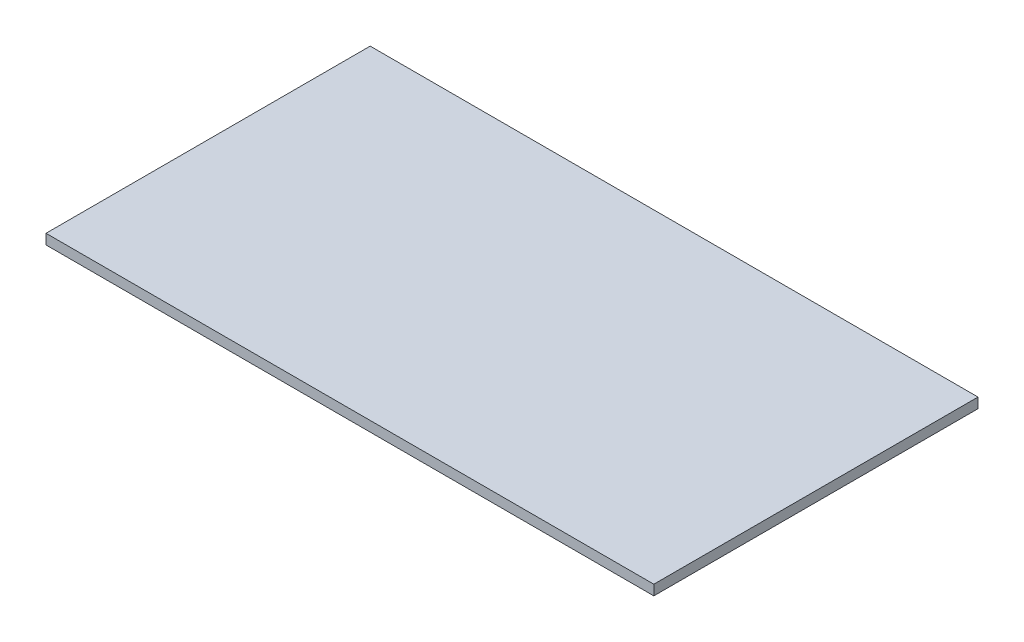
from build123d import *

# Parameters (mm, degrees)
SKETCH1_W           = 1500
SKETCH1_H           = 800
BOSS_EXTRUDE1_DEPTH = 25


with BuildPart() as part:
    # Sketch1 → Boss-Extrude1 (new body)
    with BuildSketch(Plane(origin=(0, 0, 0), x_dir=(1, 0, 0), z_dir=(0, 1, 0))):
        Rectangle(SKETCH1_W, SKETCH1_H)
    extrude(amount=BOSS_EXTRUDE1_DEPTH)


solid = part.part
